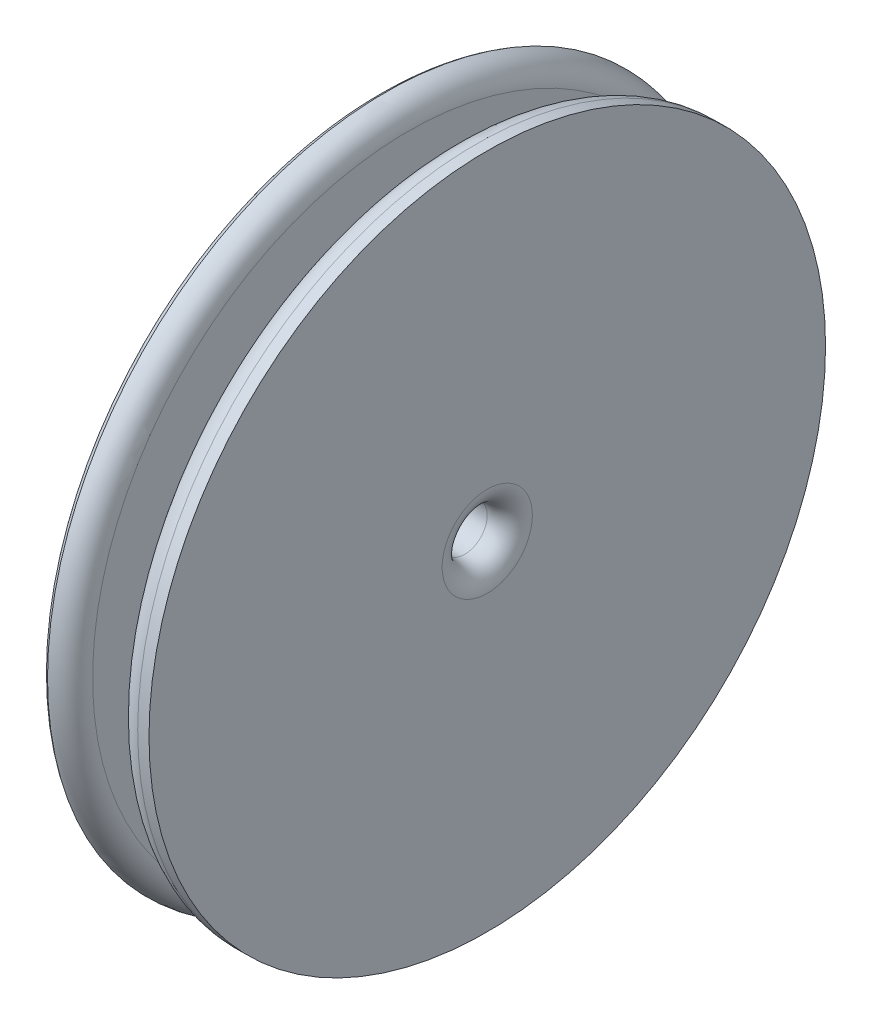
from build123d import *

# Parameters (mm, degrees)
SKETCH2_R          = 2
CUT_EXTRUDE1_DEPTH = 10
FILLET1_R          = 2
FILLET2_R          = 2
FILLET3_R          = 2


# Some blends are built 0.0001 mm under size
with BuildPart() as part:
    # Sketch1 → Revolve1 (revolve)
    with BuildSketch(Plane(origin=(0, 0, 0), x_dir=(1, 0, 0), z_dir=(0, 1, 0))):
        Polygon((0, 0), (0, 24.685714286), (3, 24.685714286), (3, 0), (7, 0), (7, 24.685714286), (10, 24.685714286), (10, -5.314285714), (0, -5.314285714), align=None)
    revolve(axis=Axis((10, 0, 5.314285714), (-1, 0, 0)))

    # Sketch2 → Cut-Extrude1 (cut)
    with BuildSketch(Plane(origin=(10, 0, 0), x_dir=(0, 0, -1), z_dir=(1, 0, 0))):
        with Locations((-5.314285714, 0)):
            Circle(SKETCH2_R)
    extrude(amount=-CUT_EXTRUDE1_DEPTH, mode=Mode.SUBTRACT)

    # Fillet1
    fillet1_edges = [part.edges().sort_by_distance(p)[0] for p in [
        (7, 0, 10.628571429),
        (3, 0, 10.628571429),
        (3, 0, 35.314285714),
    ]]
    fillet(fillet1_edges, radius=FILLET1_R - 0.0001)  # a hair under: the kernel refuses the full size

    # Fillet2
    fillet2_edges = [part.edges().sort_by_distance(p)[0] for p in [
        (10, 0, 7.314285714),
        (7, 0, 35.314285714),
    ]]
    fillet(fillet2_edges, radius=FILLET2_R)

    # Fillet3
    # the kernel refuses this fillet: 2 mm, written as the material it takes off along each edge
    with BuildSketch(Plane(origin=(0, 0, 5.314285714), x_dir=(0, 0, -1), z_dir=(0, -1, 0))) as fillet3_piece_1:
        with BuildLine():
            CenterArc((2 + FILLET3_R, FILLET3_R), FILLET3_R, 180, 90)
            Line((2 + FILLET3_R, 0), (2 + FILLET3_R, -FILLET3_R * 0.02))
            Line((2 + FILLET3_R, -FILLET3_R * 0.02), (2 - FILLET3_R * 0.02, -FILLET3_R * 0.02))
            Line((2 - FILLET3_R * 0.02, -FILLET3_R * 0.02), (2 - FILLET3_R * 0.02, FILLET3_R))
            Line((2 - FILLET3_R * 0.02, FILLET3_R), (2, FILLET3_R))
        make_face()
    revolve(axis=Axis((0, 0, 5.314285714), (1, 0, 0)), mode=Mode.SUBTRACT)
    with BuildSketch(Plane(origin=(0, 0, 5.314285714), x_dir=(0, 0, -1), z_dir=(0, 1, 0))) as fillet3_piece_2:
        with BuildLine():
            CenterArc((28.267891461, -2), FILLET3_R, 29.996692082, 60.003307918)
            Line((30, -1.0001), (30.034642171, -0.980102))
            ThreePointArc((30.034642171, -0.980102), (30.04, -0.50005), (30.04, 0))
            Line((30.04, 0), (30, 0.04))
            Line((30, 0.04), (28.267891461, 0.04))
            Line((28.267891461, 0.04), (28.267891461, 0))
        make_face()
    revolve(axis=Axis((0, 0, 5.314285714), (-1, 0, 0)), mode=Mode.SUBTRACT)


solid = part.part
